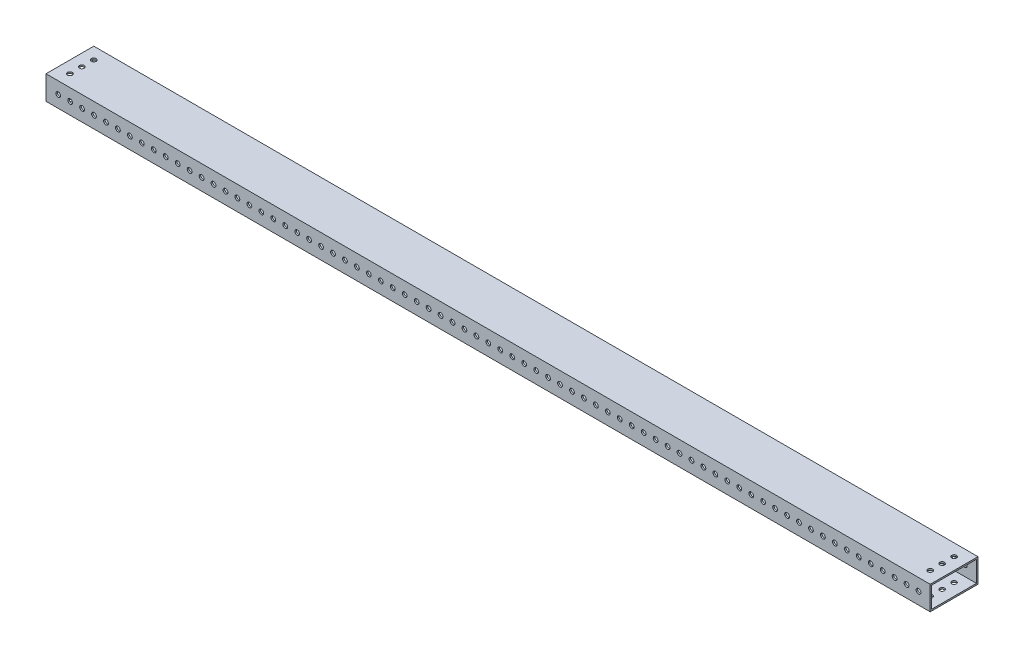
from build123d import *

# Parameters (mm, degrees)
SKETCH1_W           = 939.8
SKETCH1_H           = 50.8
BOSS_EXTRUDE1_DEPTH = 25.4
SKETCH2_W           = 47.577219443
SKETCH2_H           = 22.157059011
CUT_EXTRUDE1_DEPTH  = 941.486235944
SKETCH3_R           = 2.54
CUT_EXTRUDE2_DEPTH  = 474.319986901
SKETCH4_R           = 2.54
CUT_EXTRUDE3_DEPTH  = 472.270973008


with BuildPart() as part:
    # Sketch1 → Boss-Extrude1 (new body)
    with BuildSketch(Plane(origin=(0, 0, 0), x_dir=(1, 0, 0), z_dir=(0, 1, 0))):
        Rectangle(SKETCH1_W, SKETCH1_H)
    extrude(amount=BOSS_EXTRUDE1_DEPTH)

    # Sketch2 → Cut-Extrude1 (cut, through all)
    with BuildSketch(Plane.ZY.offset(469.9)):
        with Locations((0.005055824, 12.705024393)):
            Rectangle(SKETCH2_W, SKETCH2_H)
    extrude(amount=-CUT_EXTRUDE1_DEPTH, mode=Mode.SUBTRACT)

    # Sketch3 → Cut-Extrude2 (cut, through all)
    with BuildSketch(Plane.XY.offset(25.4)):
        with Locations((-456.946, 12.7)):
            Circle(SKETCH3_R)
        with Locations((-444.246, 12.7)):
            Circle(SKETCH3_R)
        with Locations((-431.546, 12.7)):
            Circle(SKETCH3_R)
        with Locations((-418.846, 12.7)):
            Circle(SKETCH3_R)
        with Locations((-406.146, 12.7)):
            Circle(SKETCH3_R)
        with Locations((-393.446, 12.7)):
            Circle(SKETCH3_R)
        with Locations((-380.746, 12.7)):
            Circle(SKETCH3_R)
        with Locations((-368.046, 12.7)):
            Circle(SKETCH3_R)
        with Locations((-355.346, 12.7)):
            Circle(SKETCH3_R)
        with Locations((-342.646, 12.7)):
            Circle(SKETCH3_R)
        with Locations((-329.946, 12.7)):
            Circle(SKETCH3_R)
        with Locations((-317.246, 12.7)):
            Circle(SKETCH3_R)
        with Locations((-304.546, 12.7)):
            Circle(SKETCH3_R)
        with Locations((-291.846, 12.7)):
            Circle(SKETCH3_R)
        with Locations((-279.146, 12.7)):
            Circle(SKETCH3_R)
        with Locations((-266.446, 12.7)):
            Circle(SKETCH3_R)
        with Locations((-253.746, 12.7)):
            Circle(SKETCH3_R)
        with Locations((-241.046, 12.7)):
            Circle(SKETCH3_R)
        with Locations((-228.346, 12.7)):
            Circle(SKETCH3_R)
        with Locations((-215.646, 12.7)):
            Circle(SKETCH3_R)
        with Locations((-202.946, 12.7)):
            Circle(SKETCH3_R)
        with Locations((-190.246, 12.7)):
            Circle(SKETCH3_R)
        with Locations((-177.546, 12.7)):
            Circle(SKETCH3_R)
        with Locations((-164.846, 12.7)):
            Circle(SKETCH3_R)
        with Locations((-152.146, 12.7)):
            Circle(SKETCH3_R)
        with Locations((-139.446, 12.7)):
            Circle(SKETCH3_R)
        with Locations((-126.746, 12.7)):
            Circle(SKETCH3_R)
        with Locations((-114.046, 12.7)):
            Circle(SKETCH3_R)
        with Locations((-101.346, 12.7)):
            Circle(SKETCH3_R)
        with Locations((-88.646, 12.7)):
            Circle(SKETCH3_R)
        with Locations((-75.946, 12.7)):
            Circle(SKETCH3_R)
        with Locations((-63.246, 12.7)):
            Circle(SKETCH3_R)
        with Locations((-50.546, 12.7)):
            Circle(SKETCH3_R)
        with Locations((-37.846, 12.7)):
            Circle(SKETCH3_R)
        with Locations((-25.146, 12.7)):
            Circle(SKETCH3_R)
        with Locations((-12.446, 12.7)):
            Circle(SKETCH3_R)
        with Locations((0.254, 12.7)):
            Circle(SKETCH3_R)
        with Locations((12.954, 12.7)):
            Circle(SKETCH3_R)
        with Locations((25.654, 12.7)):
            Circle(SKETCH3_R)
        with Locations((38.354, 12.7)):
            Circle(SKETCH3_R)
        with Locations((51.054, 12.7)):
            Circle(SKETCH3_R)
        with Locations((63.754, 12.7)):
            Circle(SKETCH3_R)
        with Locations((76.454, 12.7)):
            Circle(SKETCH3_R)
        with Locations((89.154, 12.7)):
            Circle(SKETCH3_R)
        with Locations((101.854, 12.7)):
            Circle(SKETCH3_R)
        with Locations((114.554, 12.7)):
            Circle(SKETCH3_R)
        with Locations((127.254, 12.7)):
            Circle(SKETCH3_R)
        with Locations((139.954, 12.7)):
            Circle(SKETCH3_R)
        with Locations((152.654, 12.7)):
            Circle(SKETCH3_R)
        with Locations((165.354, 12.7)):
            Circle(SKETCH3_R)
        with Locations((178.054, 12.7)):
            Circle(SKETCH3_R)
        with Locations((190.754, 12.7)):
            Circle(SKETCH3_R)
        with Locations((203.454, 12.7)):
            Circle(SKETCH3_R)
        with Locations((216.154, 12.7)):
            Circle(SKETCH3_R)
        with Locations((228.854, 12.7)):
            Circle(SKETCH3_R)
        with Locations((241.554, 12.7)):
            Circle(SKETCH3_R)
        with Locations((254.254, 12.7)):
            Circle(SKETCH3_R)
        with Locations((266.954, 12.7)):
            Circle(SKETCH3_R)
        with Locations((279.654, 12.7)):
            Circle(SKETCH3_R)
        with Locations((292.354, 12.7)):
            Circle(SKETCH3_R)
        with Locations((305.054, 12.7)):
            Circle(SKETCH3_R)
        with Locations((317.754, 12.7)):
            Circle(SKETCH3_R)
        with Locations((330.454, 12.7)):
            Circle(SKETCH3_R)
        with Locations((343.154, 12.7)):
            Circle(SKETCH3_R)
        with Locations((355.854, 12.7)):
            Circle(SKETCH3_R)
        with Locations((368.554, 12.7)):
            Circle(SKETCH3_R)
        with Locations((381.254, 12.7)):
            Circle(SKETCH3_R)
        with Locations((393.954, 12.7)):
            Circle(SKETCH3_R)
        with Locations((406.654, 12.7)):
            Circle(SKETCH3_R)
        with Locations((419.354, 12.7)):
            Circle(SKETCH3_R)
        with Locations((432.054, 12.7)):
            Circle(SKETCH3_R)
        with Locations((444.754, 12.7)):
            Circle(SKETCH3_R)
        with Locations((457.454, 12.7)):
            Circle(SKETCH3_R)
    extrude(amount=-CUT_EXTRUDE2_DEPTH, mode=Mode.SUBTRACT)

    # Sketch4 → Cut-Extrude3 (cut, through all)
    with BuildSketch(Plane(origin=(0, 25.4, 0), x_dir=(1, 0, 0), z_dir=(0, 1, 0))):
        with Locations((-457.2, 12.7)):
            Circle(SKETCH4_R)
        with Locations((-457.2, -12.7)):
            Circle(SKETCH4_R)
        with Locations((-457.2, 0)):
            Circle(SKETCH4_R)
        with Locations((457.2, 12.7)):
            Circle(SKETCH4_R)
        with Locations((457.2, 0)):
            Circle(SKETCH4_R)
        with Locations((457.2, -12.7)):
            Circle(SKETCH4_R)
    extrude(amount=-CUT_EXTRUDE3_DEPTH, mode=Mode.SUBTRACT)


solid = part.part
